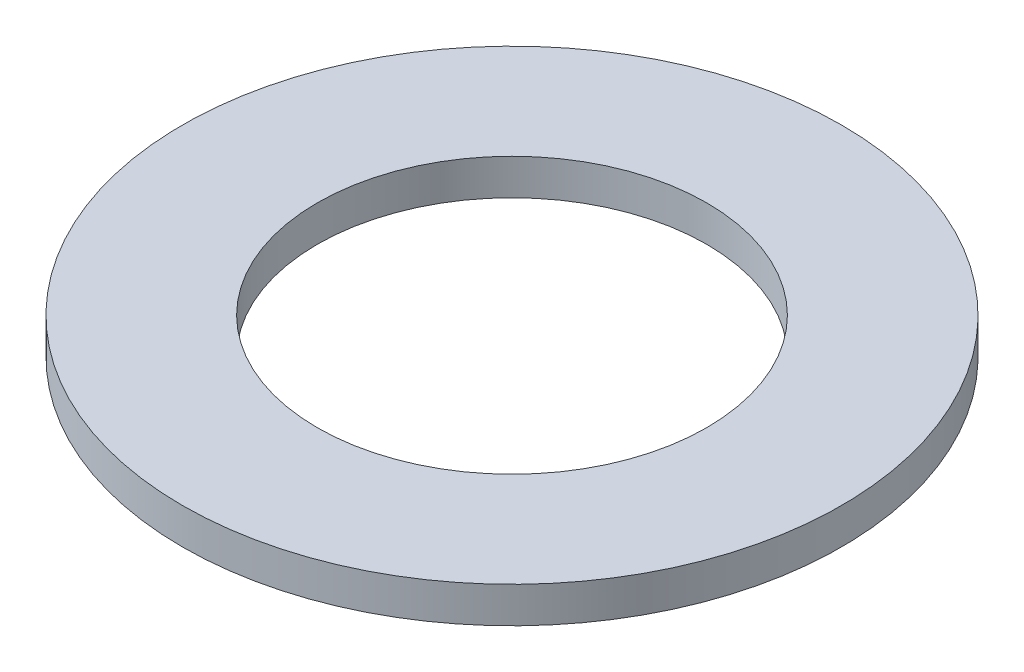
from build123d import *

# Parameters (mm, degrees)
SKETCH1_R           = 55
BOSS_EXTRUDE1_DEPTH = 6
SKETCH2_R           = 32.5
CUT_EXTRUDE1_DEPTH  = 79.012819459


with BuildPart() as part:
    # Sketch1 → Boss-Extrude1 (new body)
    with BuildSketch(Plane(origin=(0, 0, 0), x_dir=(1, 0, 0), z_dir=(0, 1, 0))):
        Circle(SKETCH1_R)
    extrude(amount=BOSS_EXTRUDE1_DEPTH)

    # Sketch2 → Cut-Extrude1 (cut, through all)
    with BuildSketch(Plane(origin=(0, 0, 0), x_dir=(1, 0, 0), z_dir=(0, 1, 0))):
        Circle(SKETCH2_R)
    extrude(amount=CUT_EXTRUDE1_DEPTH, mode=Mode.SUBTRACT)


solid = part.part
